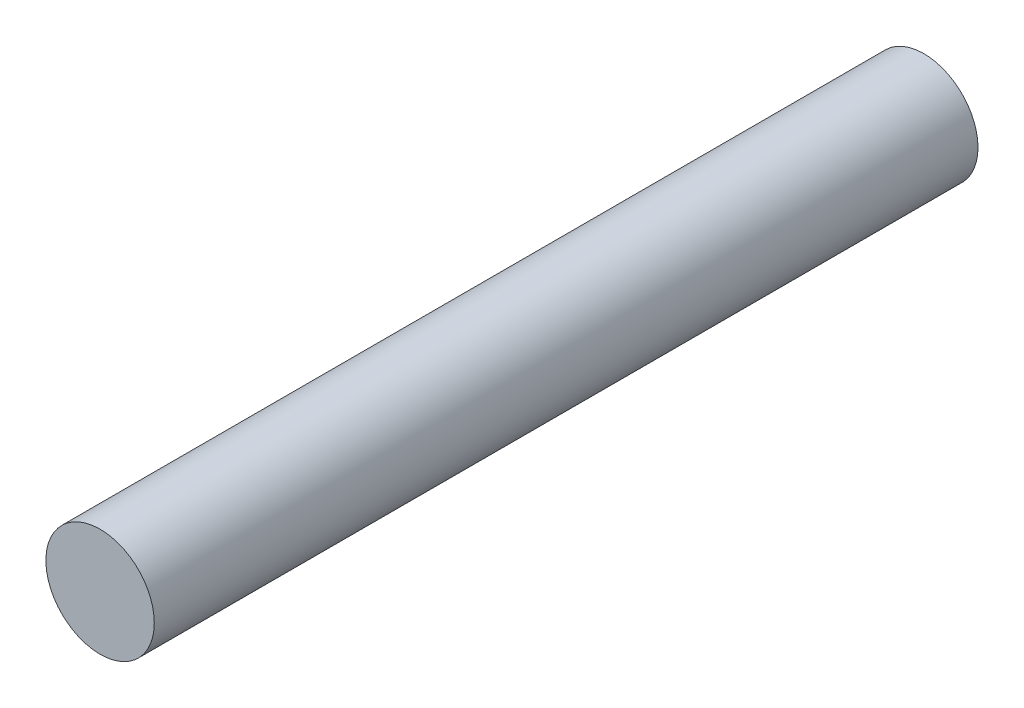
from build123d import *

# Parameters (mm, degrees)
BOSS_EXTRUDE1_OUTLINE_R = 6.35
BOSS_EXTRUDE1_DEPTH     = 96.52


# Read off the part's stored shape, not the designer's step: Boss-Extrude1
with BuildPart() as part:
    # Boss-Extrude1 outline → Boss-Extrude1 (new body)
    with BuildSketch(Plane.XY.offset(-343.808229346)):
        with Locations((286.452894146, -18.033383804)):
            Circle(BOSS_EXTRUDE1_OUTLINE_R)
    extrude(amount=BOSS_EXTRUDE1_DEPTH)


solid = part.part
